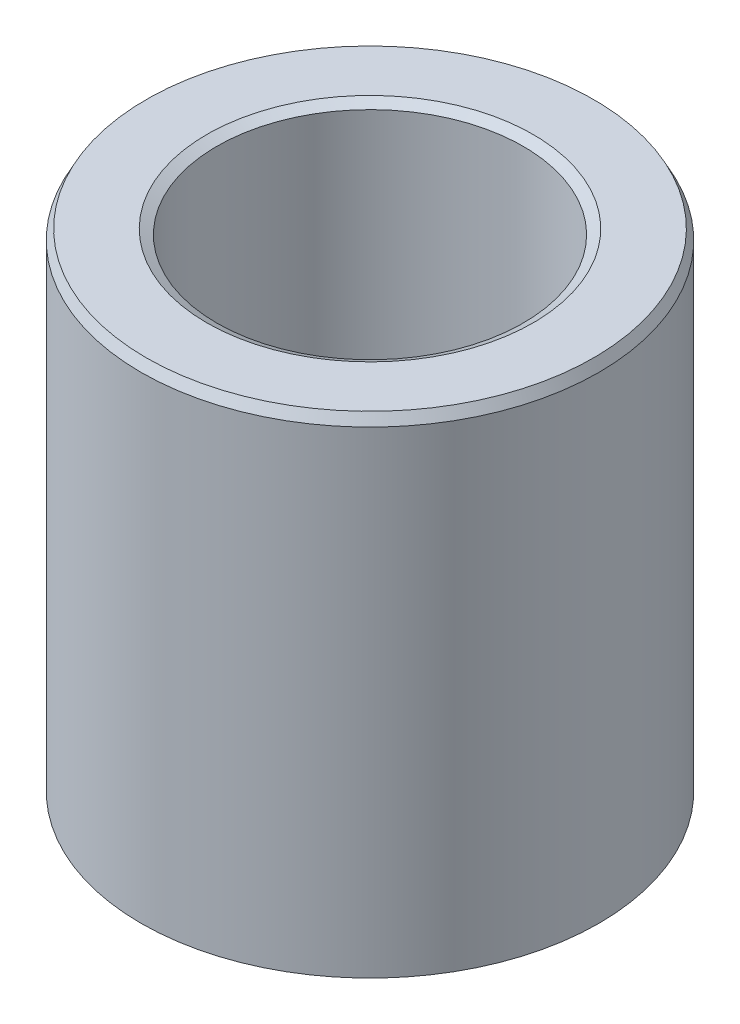
from build123d import *
from OCP.BRepFilletAPI import BRepFilletAPI_MakeChamfer

# Parameters (mm, degrees)
SKETCH1_R           = 50
BOSS_EXTRUDE1_DEPTH = 107.539626677
SKETCH2_R           = 33.456352548
CUT_EXTRUDE1_DEPTH  = 129.704200809
CHAMFER1_SIZE       = 2.18444421
CHAMFER1_SIZE2      = 1.138548646


with BuildPart() as part:
    # Sketch1 → Boss-Extrude1 (new body)
    with BuildSketch(Plane(origin=(0, 0, 0), x_dir=(1, 0, 0), z_dir=(0, 1, 0))):
        Circle(SKETCH1_R)
    extrude(amount=BOSS_EXTRUDE1_DEPTH)

    # Sketch2 → Cut-Extrude1 (cut, through all)
    with BuildSketch(Plane(origin=(0, 0, 0), x_dir=(1, 0, 0), z_dir=(0, 1, 0))):
        Circle(SKETCH2_R)
    extrude(amount=CUT_EXTRUDE1_DEPTH, mode=Mode.SUBTRACT)

    # Chamfer1: one chamfer whose edges measure the first distance from different faces: ONE call of the kernel's chamfer builder (chamfer() names one face for all edges)
    chamfer1_edges_1 = [part.edges().sort_by_distance(p)[0] for p in [
        (-33.456352548, 107.539626677, 0),
    ]]
    chamfer1_side_1 = [part.faces().sort_by_distance(p)[0] for p in [
        (-48.585786438, 107.539626677, 0),
    ]]
    chamfer1_edges_2 = [part.edges().sort_by_distance(p)[0] for p in [
        (-33.456352548, 0, 0),
    ]]
    chamfer1_side_2 = [part.faces().sort_by_distance(p)[0] for p in [
        (-33.456352548, 53.769813339, 0),
    ]]
    chamfer1_edges_3 = [part.edges().sort_by_distance(p)[0] for p in [
        (-50, 0, 0),
    ]]
    chamfer1_side_3 = [part.faces().sort_by_distance(p)[0] for p in [
        (-48.585786438, 0, 0),
    ]]
    chamfer1_edges_4 = [part.edges().sort_by_distance(p)[0] for p in [
        (-50, 107.539626677, 0),
    ]]
    chamfer1_side_4 = [part.faces().sort_by_distance(p)[0] for p in [
        (-50, 53.769813339, 0),
    ]]
    chamfer1 = BRepFilletAPI_MakeChamfer(part.part.solid().wrapped)
    for e in chamfer1_edges_1:
        chamfer1.Add(CHAMFER1_SIZE, CHAMFER1_SIZE2, e.wrapped, chamfer1_side_1[0].wrapped)  # the first distance lies on this face
    for e in chamfer1_edges_2:
        chamfer1.Add(CHAMFER1_SIZE, CHAMFER1_SIZE2, e.wrapped, chamfer1_side_2[0].wrapped)  # the first distance lies on this face
    for e in chamfer1_edges_3:
        chamfer1.Add(CHAMFER1_SIZE, CHAMFER1_SIZE2, e.wrapped, chamfer1_side_3[0].wrapped)  # the first distance lies on this face
    for e in chamfer1_edges_4:
        chamfer1.Add(CHAMFER1_SIZE, CHAMFER1_SIZE2, e.wrapped, chamfer1_side_4[0].wrapped)  # the first distance lies on this face
    add(Compound.cast(chamfer1.Shape()), mode=Mode.REPLACE)


solid = part.part
